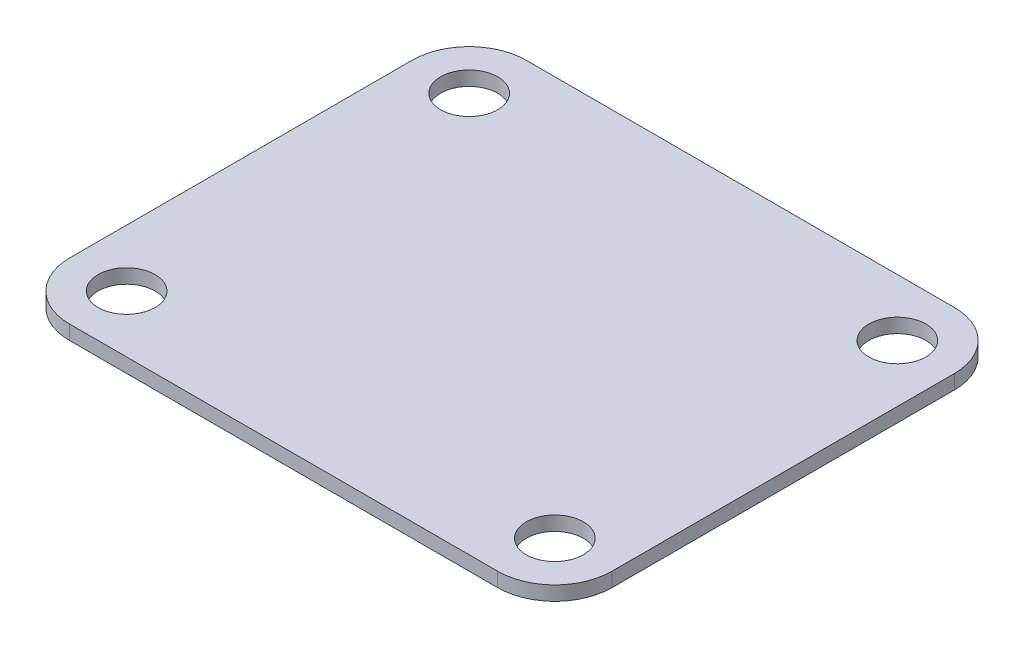
from build123d import *

# Parameters (mm, degrees)
SKETCH2_W           = 38
SKETCH2_H           = 32
SKETCH2_R           = 2
BOSS_EXTRUDE1_DEPTH = 1
FILLET1_R           = 4
SKETCH3_R           = 13
BOSS_EXTRUDE2_DEPTH = 3
SKETCH4_R           = 12
CUT_EXTRUDE1_DEPTH  = 2
FILLET2_R           = 2
SKETCH5_R           = 6
CUT_EXTRUDE4_DEPTH  = 1
SKETCH11_R          = 5
BOSS_EXTRUDE5_DEPTH = 2
FILLET7_R           = 1


with BuildPart() as part:
    # Sketch2 → Boss-Extrude1 (new body)
    with BuildSketch(Plane(origin=(0, 0, 0), x_dir=(1, 0, 0), z_dir=(0, 1, 0))):
        Rectangle(SKETCH2_W, SKETCH2_H)
        with Locations(Location((-15, 12, 0), (0, 0, 270))):
            Circle(SKETCH2_R, mode=Mode.SUBTRACT)
        with Locations(Location((15, 12, 0), (0, 0, 90))):
            Circle(SKETCH2_R, mode=Mode.SUBTRACT)
        with Locations(Location((15, -12, 0), (0, 0, 270))):
            Circle(SKETCH2_R, mode=Mode.SUBTRACT)
        with Locations(Location((-15, -12, 0), (0, 0, 90))):
            Circle(SKETCH2_R, mode=Mode.SUBTRACT)
    extrude(amount=BOSS_EXTRUDE1_DEPTH)

    # Fillet1
    fillet1_edges = [part.edges().sort_by_distance(p)[0] for p in [
        (-19, 0.5, -16),
        (19, 0.5, -16),
        (19, 0.5, 16),
        (-19, 0.5, 16),
    ]]
    fillet(fillet1_edges, radius=FILLET1_R)

    # Sketch3 → Boss-Extrude2 (add)
    with BuildSketch(Plane.XZ):
        with Locations(Location((0, 0, 0), (0, 0, 270))):
            Circle(SKETCH3_R)
    extrude(amount=BOSS_EXTRUDE2_DEPTH)

    # Sketch4 → Cut-Extrude1 (cut)
    with BuildSketch(Plane.XZ.offset(3)):
        with Locations(Location((0, 0, 0), (0, 0, 270))):
            Circle(SKETCH4_R)
    extrude(amount=-CUT_EXTRUDE1_DEPTH, mode=Mode.SUBTRACT)

    # Fillet2
    fillet2_edges = [part.edges().sort_by_distance(p)[0] for p in [
        (0, 0, 13),
    ]]
    fillet(fillet2_edges, radius=FILLET2_R)

    # Sketch5 → Cut-Extrude4 (cut)
    with BuildSketch(Plane.XZ.offset(1)):
        with Locations(Location((0, 0, 0), (0, 0, 270))):
            Circle(SKETCH5_R)
    extrude(amount=-CUT_EXTRUDE4_DEPTH, mode=Mode.SUBTRACT)

    # Sketch11 → Boss-Extrude5 (add)
    with BuildSketch(Plane.XZ):
        with Locations(Location((0, 0, 0), (0, 0, 270))):
            Circle(SKETCH11_R)
    extrude(amount=BOSS_EXTRUDE5_DEPTH)

    # Fillet7
    fillet7_edges = [part.edges().sort_by_distance(p)[0] for p in [
        (0, -1, 12),
        (0, -1, 6),
        (0, -2, 5),
    ]]
    fillet(fillet7_edges, radius=FILLET7_R - 0.0001)  # a hair under: the kernel refuses the full size


solid = part.part
